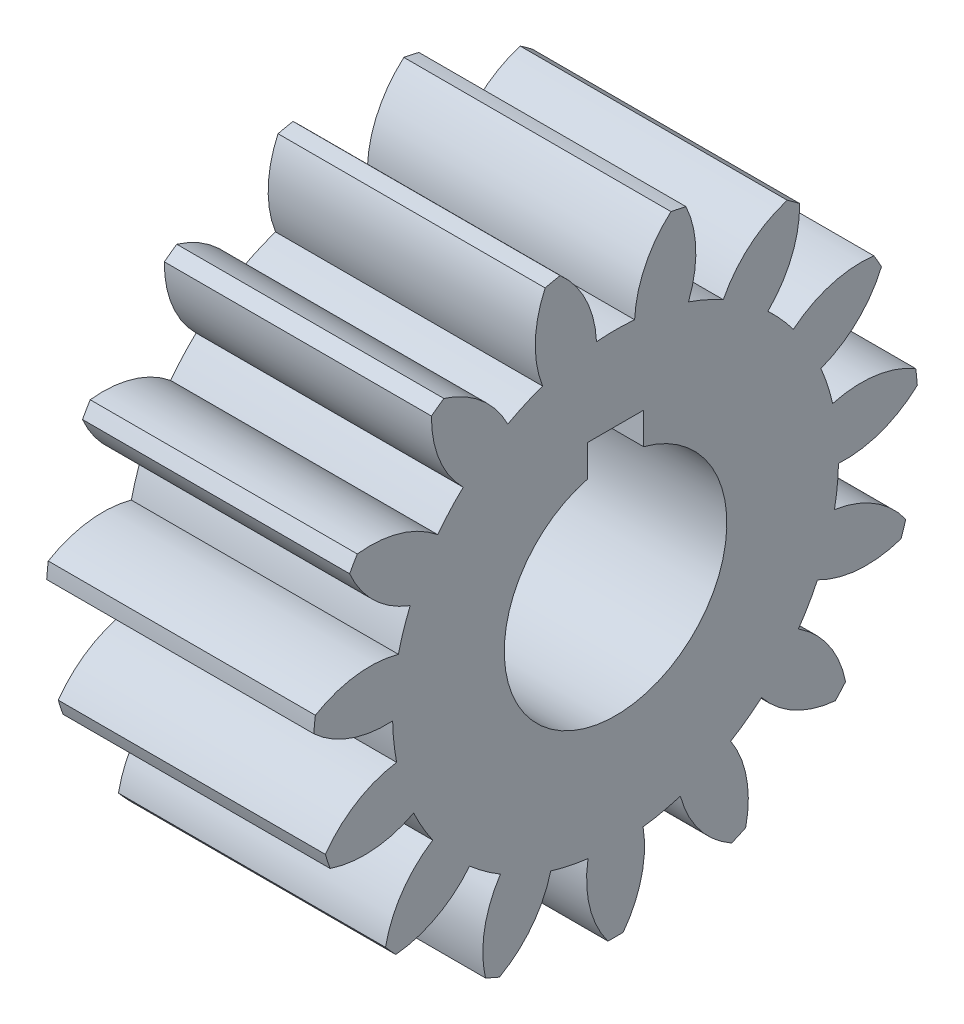
from build123d import *

# Parameters (mm, degrees)
SPUR_START             = -48.028721504
SPUR_GEAR_AI_OUTLINE_R = 3.96875
SPUR_GEAR_AI_DEPTH     = 9.525
CUT_EXTRUDE1_DEPTH     = 38.391363975


# Read off the part's stored shape, not the designer's step: spur gear_ai
with BuildPart() as part:
    # spur gear_ai outline → spur gear_ai (new body)
    with BuildSketch(Plane.YZ.offset(SPUR_START)):
        with BuildLine():
            ThreePointArc((14.065180693, 15.046177845), (14.228771479, 15.265443857), (14.386753515, 15.488784863))
            ThreePointArc((14.386753515, 15.488784863), (13.653794557, 16.82563811), (12.455383467, 17.768090388))
            ThreePointArc((12.455383467, 17.768090388), (12.758302122, 18.376947995), (13.008079359, 19.009465686))
            ThreePointArc((13.008079359, 19.009465686), (14.510351432, 18.74949635), (15.994272276, 19.099331116))
            ThreePointArc((15.994272276, 19.099331116), (16.054536374, 19.366178952), (16.108019174, 19.634468198))
            ThreePointArc((16.108019174, 19.634468198), (14.894680646, 20.557623143), (13.416547762, 20.931158437))
            ThreePointArc((13.416547762, 20.931158437), (13.445633024, 21.610585655), (13.416547762, 22.290012873))
            ThreePointArc((13.416547762, 22.290012873), (14.894680646, 22.663548167), (16.108019174, 23.586703112))
            ThreePointArc((16.108019174, 23.586703112), (16.054536374, 23.854992358), (15.994272276, 24.121840194))
            ThreePointArc((15.994272276, 24.121840194), (14.510351432, 24.47167496), (13.008079359, 24.211705624))
            ThreePointArc((13.008079359, 24.211705624), (12.758302122, 24.844223315), (12.455383467, 25.453080922))
            ThreePointArc((12.455383467, 25.453080922), (13.653794557, 26.3955332), (14.386753515, 27.732386447))
            ThreePointArc((14.386753515, 27.732386447), (14.228771479, 27.955727454), (14.065180693, 28.174993465))
            ThreePointArc((14.065180693, 28.174993465), (12.567260927, 27.891018444), (11.300606153, 27.042495538))
            ThreePointArc((11.300606153, 27.042495538), (10.815155171, 27.518735647), (10.290780511, 27.951746631))
            ThreePointArc((10.290780511, 27.951746631), (11.002253642, 29.300157333), (11.128097767, 30.81955481))
            ThreePointArc((11.128097767, 30.81955481), (10.892933024, 30.959329889), (10.654301883, 31.093100991))
            ThreePointArc((10.654301883, 31.093100991), (9.401387132, 30.224418043), (8.589365776, 28.934058886))
            ThreePointArc((8.589365776, 28.934058886), (7.952179933, 29.171675171), (7.29701841, 29.353968))
            ThreePointArc((7.29701841, 29.353968), (7.398533415, 30.875184664), (6.895503115, 32.314408745))
            ThreePointArc((6.895503115, 32.314408745), (6.623817785, 32.346449516), (6.351407781, 32.371595469))
            ThreePointArc((6.351407781, 32.371595469), (5.560138388, 31.068407768), (5.343156318, 29.559327181))
            ThreePointArc((5.343156318, 29.559327181), (4.664410836, 29.517233628), (3.991745829, 29.417288215))
            ThreePointArc((3.991745829, 29.417288215), (3.465749841, 30.848278661), (2.420823624, 31.958474427))
            ThreePointArc((2.420823624, 31.958474427), (2.15959457, 31.877240748), (1.900507868, 31.789413589))
            ThreePointArc((1.900507868, 31.789413589), (1.707701498, 30.277054127), (2.123276886, 28.810185853))
            ThreePointArc((2.123276886, 28.810185853), (1.520333024, 28.49566082), (0.946474424, 28.130758636))
            ThreePointArc((0.946474424, 28.130758636), (-0.116083071, 29.224091616), (-1.522227969, 29.813296133))
            ThreePointArc((-1.522227969, 29.813296133), (-1.727831871, 29.632834046), (-1.928796828, 29.447219888))
            ThreePointArc((-1.928796828, 29.447219888), (-1.4898022, 27.987189356), (-0.513526115, 26.816168245))
            ThreePointArc((-0.513526115, 26.816168245), (-0.936413884, 26.283595967), (-1.312240712, 25.716831914))
            ThreePointArc((-1.312240712, 25.716831914), (-2.727633872, 26.283460223), (-4.251862224, 26.249794677))
            ThreePointArc((-4.251862224, 26.249794677), (-4.366290191, 26.001307717), (-4.474384734, 25.750000935))
            ThreePointArc((-4.474384734, 25.750000935), (-3.479495269, 24.594751875), (-2.11132549, 23.922058116))
            ThreePointArc((-2.11132549, 23.922058116), (-2.281036031, 23.263525179), (-2.393847214, 22.59289791))
            ThreePointArc((-2.393847214, 22.59289791), (-3.917341702, 22.534846366), (-5.296100578, 21.884131836))
            ThreePointArc((-5.296100578, 21.884131836), (-5.299566976, 21.610585655), (-5.296100578, 21.337039474))
            ThreePointArc((-5.296100578, 21.337039474), (-3.917341702, 20.686324945), (-2.393847214, 20.6282734))
            ThreePointArc((-2.393847214, 20.6282734), (-2.281036031, 19.957646131), (-2.11132549, 19.299113194))
            ThreePointArc((-2.11132549, 19.299113194), (-3.479495269, 18.626419435), (-4.474384734, 17.471170375))
            ThreePointArc((-4.474384734, 17.471170375), (-4.366290191, 17.219863593), (-4.251862224, 16.971376633))
            ThreePointArc((-4.251862224, 16.971376633), (-2.727633872, 16.937711087), (-1.312240712, 17.504339396))
            ThreePointArc((-1.312240712, 17.504339396), (-0.936413884, 16.937575343), (-0.513526115, 16.405003065))
            ThreePointArc((-0.513526115, 16.405003065), (-1.4898022, 15.233981954), (-1.928796828, 13.773951422))
            ThreePointArc((-1.928796828, 13.773951422), (-1.727831871, 13.588337264), (-1.522227969, 13.407875177))
            ThreePointArc((-1.522227969, 13.407875177), (-0.116083071, 13.997079694), (0.946474424, 15.090412674))
            ThreePointArc((0.946474424, 15.090412674), (1.520333024, 14.72551049), (2.123276886, 14.410985457))
            ThreePointArc((2.123276886, 14.410985457), (1.707701498, 12.944117183), (1.900507868, 11.431757721))
            ThreePointArc((1.900507868, 11.431757721), (2.15959457, 11.343930562), (2.420823624, 11.262696883))
            ThreePointArc((2.420823624, 11.262696883), (3.465749841, 12.372892649), (3.991745829, 13.803883095))
            ThreePointArc((3.991745829, 13.803883095), (4.664410836, 13.703937682), (5.343156318, 13.661844129))
            ThreePointArc((5.343156318, 13.661844129), (5.560138388, 12.152763542), (6.351407781, 10.849575841))
            ThreePointArc((6.351407781, 10.849575841), (6.623817785, 10.874721795), (6.895503115, 10.906762565))
            ThreePointArc((6.895503115, 10.906762565), (7.398533415, 12.345986646), (7.29701841, 13.86720331))
            ThreePointArc((7.29701841, 13.86720331), (7.952179933, 14.049496139), (8.589365776, 14.287112424))
            ThreePointArc((8.589365776, 14.287112424), (9.401387132, 12.996753267), (10.654301883, 12.128070319))
            ThreePointArc((10.654301883, 12.128070319), (10.892933024, 12.261841421), (11.128097767, 12.4016165))
            ThreePointArc((11.128097767, 12.4016165), (11.002253642, 13.921013977), (10.290780511, 15.269424679))
            ThreePointArc((10.290780511, 15.269424679), (10.815155171, 15.702435663), (11.300606153, 16.178675772))
            ThreePointArc((11.300606153, 16.178675772), (12.567260927, 15.330152866), (14.065180693, 15.046177845))
        make_face()
        with Locations((5.495433024, 21.610585655)):
            Circle(SPUR_GEAR_AI_OUTLINE_R, mode=Mode.SUBTRACT)
    extrude(amount=SPUR_GEAR_AI_DEPTH)

    # Sketch1 → Cut-Extrude1 (cut, through all)
    with BuildSketch(Plane(origin=(-38.503721504, 0, 0), x_dir=(0, 0, -1), z_dir=(1, 0, 0))):
        with BuildLine():
            Line((-20.610585655, 9.336133034), (-20.610585655, 10.464183024))
            Line((-20.610585655, 10.464183024), (-22.610585655, 10.464183024))
            Line((-22.610585655, 10.464183024), (-22.610585655, 9.336133034))
            ThreePointArc((-22.610585655, 9.336133034), (-21.610585655, 9.464183024), (-20.610585655, 9.336133034))
        make_face()
    extrude(amount=-CUT_EXTRUDE1_DEPTH, mode=Mode.SUBTRACT)


solid = part.part
